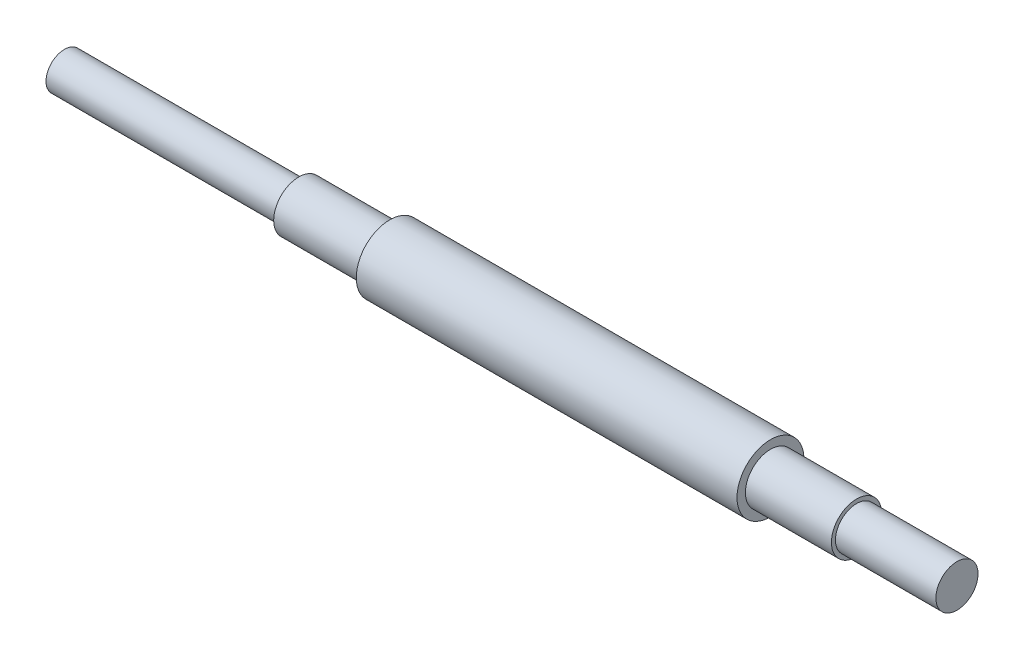
from build123d import *


with BuildPart() as part:
    # Sketch1 → Revolve1 (revolve)
    with BuildSketch(Plane(origin=(0, 0, 0), x_dir=(1, 0, 0), z_dir=(0, 1, 0))):
        Polygon((-78.63058905, 0), (-78.63058905, 3.499993), (-34.18058905, 3.499993), (-34.18058905, 4.7625), (-16.92514985, 4.7625), (-16.92514985, 6.35), (55.29481015, 6.35), (55.29481015, 4.7625), (71.61617135, 4.7625), (71.61617135, 3.99923), (90.66617135, 3.99923), (90.66617135, 0), align=None)
    revolve(axis=Axis((-97.950567047, 0, 0), (1, 0, 0)))


solid = part.part
